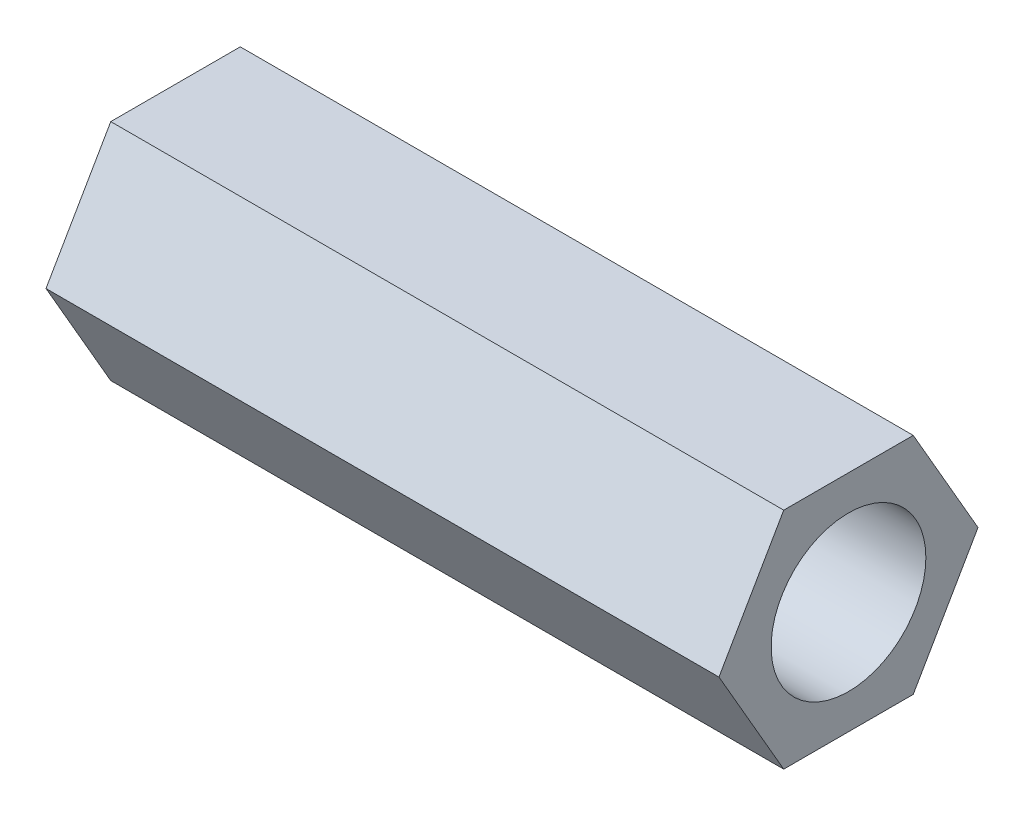
from build123d import *

# Parameters (mm, degrees)
BOSS_EXTRUDE1_DEPTH = 38.1
SKETCH2_R           = 4.381000001
CUT_EXTRUDE1_DEPTH  = 40.315338398


with BuildPart() as part:
    # Sketch1 → Boss-Extrude1 (new body)
    with BuildSketch(Plane(origin=(0, 0, 0), x_dir=(0, 0, -1), z_dir=(1, 0, 0))):
        Polygon((7.332348419, 0), (3.666174209, 6.35), (-3.666174209, 6.35), (-7.332348419, 0), (-3.666174209, -6.35), (3.666174209, -6.35), align=None)
    extrude(amount=BOSS_EXTRUDE1_DEPTH)

    # Sketch2 → Cut-Extrude1 (cut, through all)
    with BuildSketch(Plane(origin=(38.1, 0, 0), x_dir=(0, 0, -1), z_dir=(1, 0, 0))):
        Circle(SKETCH2_R)
    extrude(amount=-CUT_EXTRUDE1_DEPTH, mode=Mode.SUBTRACT)


solid = part.part
